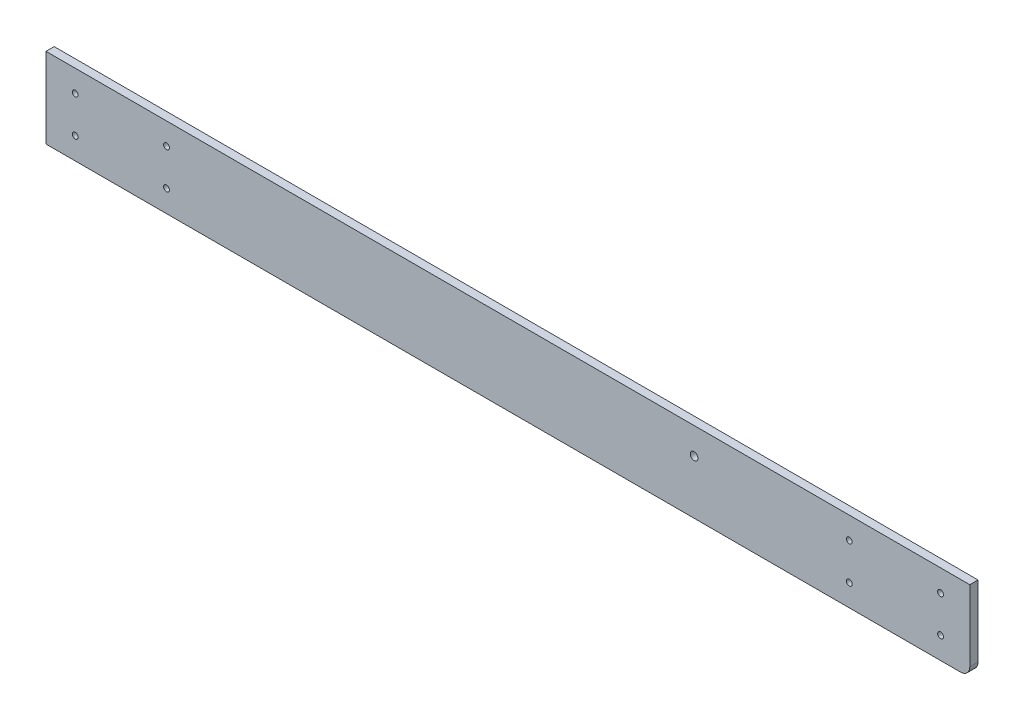
from build123d import *

# Parameters (mm, degrees)
SKETCH2_W           = 506
SKETCH2_H           = 44
SKETCH2_R           = 2.1
SKETCH2_R_2         = 1.6
BOSS_EXTRUDE1_DEPTH = 4.5
FILLET1_R           = 5


with BuildPart() as part:
    # Sketch2 → Boss-Extrude1 (new body)
    with BuildSketch(Plane.XY):
        Rectangle(SKETCH2_W, SKETCH2_H)
        with Locations((102, 7.5)):
            Circle(SKETCH2_R, mode=Mode.SUBTRACT)
        with Locations((237, 10)):
            Circle(SKETCH2_R_2, mode=Mode.SUBTRACT)
        with Locations((187, 10)):
            Circle(SKETCH2_R_2, mode=Mode.SUBTRACT)
        with Locations((187, -10)):
            Circle(SKETCH2_R_2, mode=Mode.SUBTRACT)
        with Locations((237, -10)):
            Circle(SKETCH2_R_2, mode=Mode.SUBTRACT)
        with Locations((-187, 10)):
            Circle(SKETCH2_R_2, mode=Mode.SUBTRACT)
        with Locations((-187, -10)):
            Circle(SKETCH2_R_2, mode=Mode.SUBTRACT)
        with Locations((-237, -10)):
            Circle(SKETCH2_R_2, mode=Mode.SUBTRACT)
        with Locations((-237, 10)):
            Circle(SKETCH2_R_2, mode=Mode.SUBTRACT)
    extrude(amount=BOSS_EXTRUDE1_DEPTH)

    # Fillet1
    fillet1_edges = [part.edges().sort_by_distance(p)[0] for p in [
        (253, -22, 2.25),
    ]]
    fillet(fillet1_edges, radius=FILLET1_R)


solid = part.part
